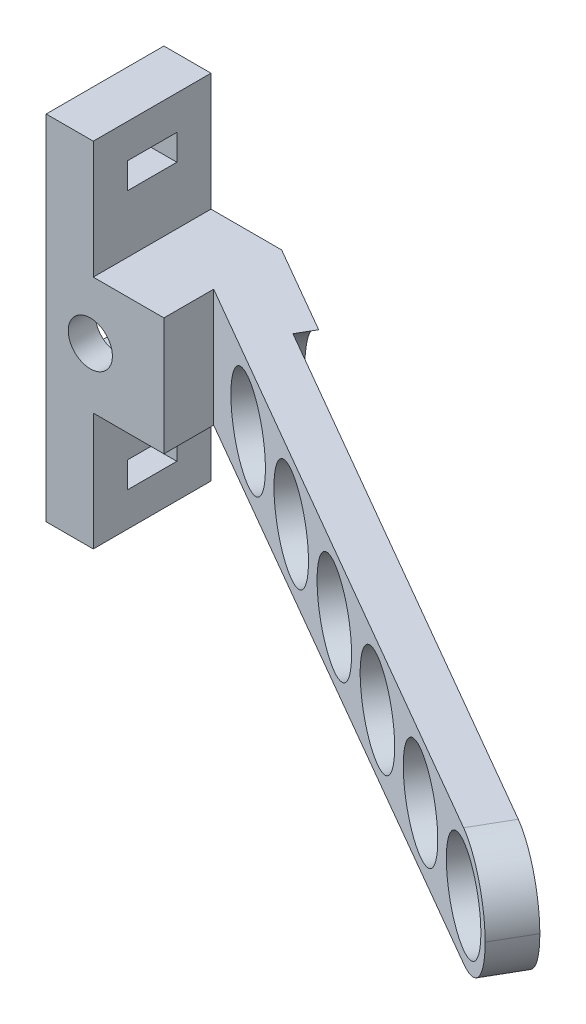
from build123d import *

# Parameters (mm, degrees)
SKETCH1_W           = 12.7
SKETCH1_H           = 12.7
BOSS_EXTRUDE1_DEPTH = 12.7
SKETCH2_W           = 12.7
SKETCH2_H           = 12.7
SKETCH2_W_2         = 5.334
SKETCH2_H_2         = 2.794
BOSS_EXTRUDE2_DEPTH = 5.08
SKETCH3_W           = 6.858
SKETCH3_H           = 10.16
CUT_EXTRUDE1_DEPTH  = 9.525
SKETCH4_R           = 2.38125
CUT_EXTRUDE2_DEPTH  = 32.108519733
BOSS_EXTRUDE3_DEPTH = 12.7
SKETCH8_R           = 5.08
CUT_EXTRUDE5_DEPTH  = 91.094949376
FILLET2_R           = 6.35
SKETCH9_R           = 6.985
SKETCH9_W           = 80.922597298
SKETCH9_H           = 13.97
CUT_EXTRUDE6_DEPTH  = 2.032


with BuildPart() as part:
    # Sketch1 → Boss-Extrude1 (new body)
    with BuildSketch(Plane.XY):
        with Locations((-6.35, 6.35)):
            Rectangle(SKETCH1_W, SKETCH1_H)
    extrude(amount=BOSS_EXTRUDE1_DEPTH)

    # Sketch2 → Boss-Extrude2 (add)
    # profile 1 of 2: a face of its own
    with BuildSketch(Plane.ZY.offset(12.7)):
        with Locations((6.35, 19.05)):
            Rectangle(SKETCH2_W, SKETCH2_H)
        with Locations((6.35, 20.32)):
            Rectangle(SKETCH2_W_2, SKETCH2_H_2, mode=Mode.SUBTRACT)
    # profile 2 of 2: a face of its own
    with BuildSketch(Plane.ZY.offset(12.7)):
        with Locations((6.35, -6.35)):
            Rectangle(SKETCH2_W, SKETCH2_H)
        with Locations((6.35, -7.62)):
            Rectangle(SKETCH2_W_2, SKETCH2_H_2, mode=Mode.SUBTRACT)
    extrude(amount=-BOSS_EXTRUDE2_DEPTH)

    # Sketch3 → Cut-Extrude1 (cut)
    with BuildSketch(Plane.ZY.offset(12.7)):
        with Locations((6.35, 6.35)):
            Rectangle(SKETCH3_W, SKETCH3_H)
    extrude(amount=-CUT_EXTRUDE1_DEPTH, mode=Mode.SUBTRACT)

    # Sketch4 → Cut-Extrude2 (cut, through all)
    with BuildSketch(Plane.XY.offset(12.7)):
        with Locations((-7.9375, 6.35)):
            Circle(SKETCH4_R)
    extrude(amount=-CUT_EXTRUDE2_DEPTH, mode=Mode.SUBTRACT)

    # Sketch7 → Boss-Extrude3 (add)
    with BuildSketch(Plane(origin=(0, 12.7, 0), x_dir=(1, 0, 0), z_dir=(0, 1, 0))):
        Polygon((72.465692557, -41.838087105), (69.290692557, -47.337348419), (0, -7.332348419), (3.175, -1.833087105), align=None)
        Polygon((0, 0), (0, -7.332348419), (3.175, -1.833087105), align=None)
    extrude(amount=-BOSS_EXTRUDE3_DEPTH)

    # Sketch8 → Cut-Extrude5 (cut, through all)
    with BuildSketch(Plane(origin=(-3.175, 0, 5.499261314), x_dir=(0.8660254037844417, 0, 0.49999999999999495), z_dir=(-0.49999999999999495, 0, 0.8660254037844417))):
        with Locations((13.826174209, 6.35)):
            Circle(SKETCH8_R)
        with Locations((26.526174209, 6.35)):
            Circle(SKETCH8_R)
        with Locations((39.226174209, 6.35)):
            Circle(SKETCH8_R)
        with Locations((51.926174209, 6.35)):
            Circle(SKETCH8_R)
        with Locations((64.626174209, 6.35)):
            Circle(SKETCH8_R)
        with Locations((77.326174209, 6.35)):
            Circle(SKETCH8_R)
    extrude(amount=-CUT_EXTRUDE5_DEPTH, mode=Mode.SUBTRACT)

    # Fillet2
    fillet2_edges = [part.edges().sort_by_distance(p)[0] for p in [
        (70.878192557, 0, 44.587717762),
        (70.878192557, 12.7, 44.587717762),
    ]]
    fillet(fillet2_edges, radius=FILLET2_R - 0.0001)  # a hair under: the kernel refuses the full size

    # Sketch9 → Cut-Extrude6 (cut)
    with BuildSketch(Plane(origin=(0, 0, 0), x_dir=(-0.8660254037844417, 0, -0.4999999999999947), z_dir=(0.4999999999999947, 0, -0.8660254037844417))):
        with Locations((-13.826174209, 6.35)):
            Circle(SKETCH9_R)
        with Locations((-54.287472858, 6.35)):
            Rectangle(SKETCH9_W, SKETCH9_H)
    extrude(amount=-CUT_EXTRUDE6_DEPTH, mode=Mode.SUBTRACT)


solid = part.part
